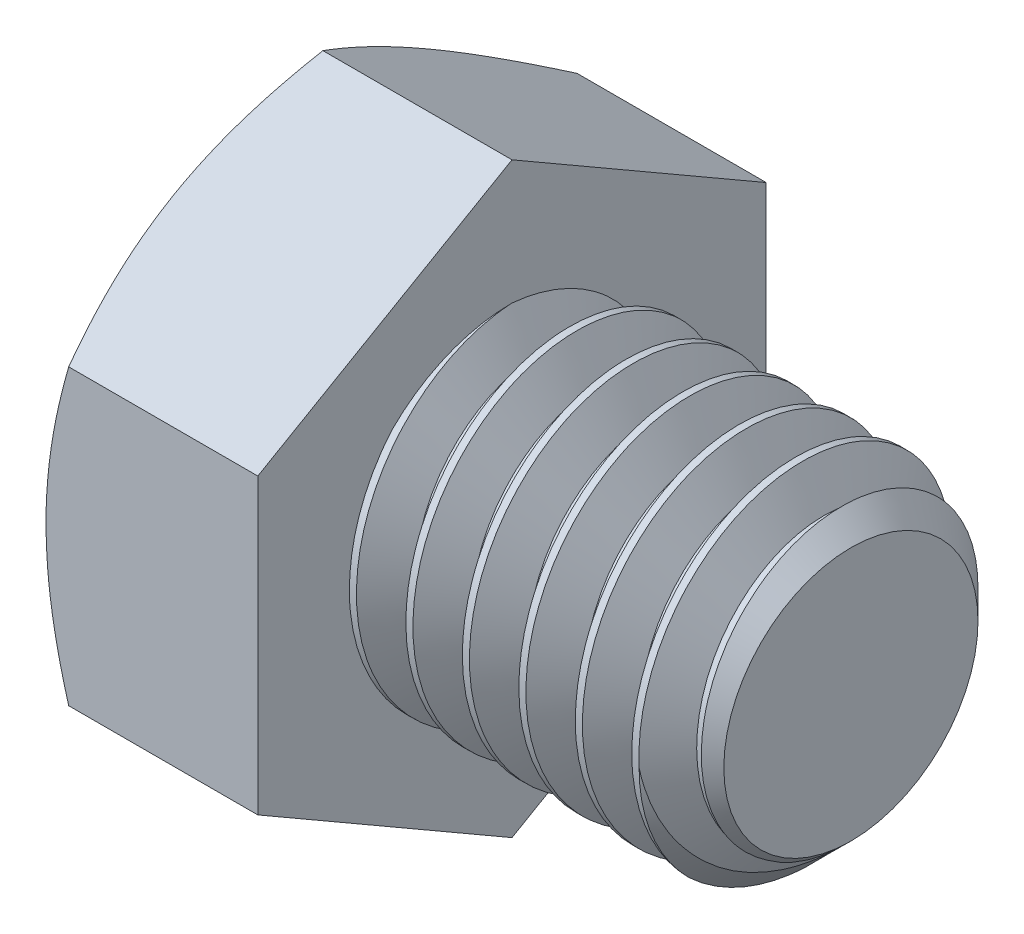
from build123d import *

# Parameters (mm, degrees)
SKETCH5_R           = 4.7625
BOSS_EXTRUDE3_DEPTH = 9.525
CHAMFER1_SIZE       = 1.190625
CUT_SWEEP1_PITCH    = 1.5875
BOSS_EXTRUDE4_DEPTH = 5.953125
SKETCH8_OUTSIDE_W   = 90.706
SKETCH8_OUTSIDE_H   = 92.916
SKETCH8_OUTSIDE_R   = 7.14375
CUT_EXTRUDE3_DEPTH  = 19.938050124
CUT_EXTRUDE3_DRAFT  = -60


with BuildPart() as part:
    # Sketch5 → Boss-Extrude3 (new body)
    with BuildSketch(Plane(origin=(7.7390625, 0, 0), x_dir=(0, 0, -1), z_dir=(1, 0, 0))):
        Circle(SKETCH5_R)
    extrude(amount=-BOSS_EXTRUDE3_DEPTH)

    # Chamfer1
    chamfer1_edges = [part.edges().sort_by_distance(p)[0] for p in [
        (7.7390625, 0, 4.7625),
    ]]
    chamfer(chamfer1_edges, length=CHAMFER1_SIZE)

    # Cut-Sweep1: the profile of Sketch10 profile screwed along a right-hand helix of 7 turns, 8 arcs to a turn; built about Z, then put on its axis
    cut_sweep1_z = Axis((0, 0, 0), (0, 0, 1))
    cut_sweep1_corners = [(4.7628, 0, 0.000173205), (3.731388504, 0, -0.5953125), (3.731388504, 0, -0.79375), (4.7628, 0, -1.389235705)]
    with BuildLine(mode=Mode.PRIVATE) as cut_sweep1_profile:
        Line(cut_sweep1_corners[0], cut_sweep1_corners[1])
        Line(cut_sweep1_corners[1], cut_sweep1_corners[2])
        Line(cut_sweep1_corners[2], cut_sweep1_corners[3])
        Line(cut_sweep1_corners[3], cut_sweep1_corners[0])
    cut_sweep1_cap = Face(cut_sweep1_profile.wire())
    cut_sweep1_turn_angles = [0, 22.5, 45, 67.5, 90, 112.5, 135, 157.5, 180, 202.5, 225, 247.5, 270, 292.5, 315, 337.5, 360]
    cut_sweep1_turn_weights = [1, 0.9238795325112867, 1, 0.9238795325112867, 1, 0.9238795325112867, 1, 0.9238795325112867, 1, 0.9238795325112867, 1, 0.9238795325112867, 1, 0.9238795325112867, 1, 0.9238795325112867, 1]
    cut_sweep1_turn_rails = [Edge.make_bspline([Vector(p[0], p[1], 0).rotate(cut_sweep1_z, cut_sweep1_turn_angles[k]) / cut_sweep1_turn_weights[k] + Vector(0, 0, p[2] + CUT_SWEEP1_PITCH * cut_sweep1_turn_angles[k] / 360) for k in range(17)], [0, 0, 0, 1, 1, 2, 2, 3, 3, 4, 4, 5, 5, 6, 6, 7, 7, 8, 8, 8], 2, cut_sweep1_turn_weights) for p in cut_sweep1_corners]
    cut_sweep1_turn_sides = [Face.make_surface_from_curves(cut_sweep1_turn_rails[p[0]], cut_sweep1_turn_rails[p[1]]) for p in [(0, 1), (1, 2), (2, 3), (3, 0)]]
    cut_sweep1 = Plane(origin=(7.7390625, 0, 0), x_dir=(0, 1, 0), z_dir=(-1, 0, 0)) * Solid(Shell([*[p.moved(Location((0, 0, CUT_SWEEP1_PITCH * i))) for i in range(7) for p in cut_sweep1_turn_sides], cut_sweep1_cap, cut_sweep1_cap.rotate(cut_sweep1_z, 2520).moved(Location((0, 0, CUT_SWEEP1_PITCH * 2520 / 360)))]))
    add(cut_sweep1, mode=Mode.SUBTRACT)

    # Sketch6 → Boss-Extrude4 (add)
    with BuildSketch(Plane.ZY.offset(1.7859375)):
        Polygon((7.14375, 4.124445986), (0, 8.248891971), (-7.14375, 4.124445986), (-7.14375, -4.124445986), (0, -8.248891971), (7.14375, -4.124445986), align=None)
    extrude(amount=BOSS_EXTRUDE4_DEPTH)


with BuildPart() as cut_extrude3_tool:
    # Sketch8 outside → Cut-Extrude3 (with draft: the straight prism first)
    with BuildSketch(Plane.ZY.offset(7.7390625)):
        Rectangle(SKETCH8_OUTSIDE_W, SKETCH8_OUTSIDE_H)
        Circle(SKETCH8_OUTSIDE_R, mode=Mode.SUBTRACT)
    extrude(amount=-CUT_EXTRUDE3_DEPTH)
    # Cut-Extrude3: the draft: its side faces are tilted about the plane it starts from
    cut_extrude3_sides = [cut_extrude3_tool.faces().sort_by_distance(p)[0] for p in [
        (2.229962562, -46.458, 0),
        (2.229962562, 0, 45.353),
        (2.229962562, 46.458, 0),
        (2.229962562, 0, -45.353),
        (2.229962562, 0, -7.14375),
    ]]
    draft(cut_extrude3_sides, Plane.ZY.offset(7.7390625), CUT_EXTRUDE3_DRAFT)


with BuildPart() as part_1:
    add(part.part)

    # Cut-Extrude3: cut by cut_extrude3_tool
    add(cut_extrude3_tool.part, mode=Mode.SUBTRACT)


solid = part_1.part
